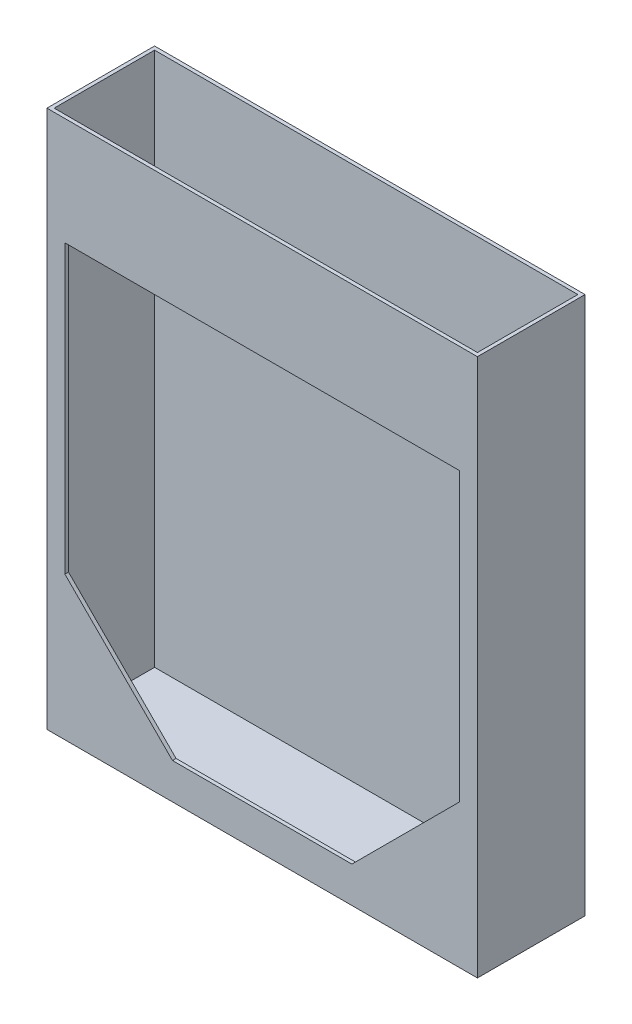
from build123d import *

# Parameters (mm, degrees)
SKETCH1_W           = 304.8
SKETCH1_H           = 76.2
BOSS_EXTRUDE1_DEPTH = 190.5
SHELL1_T            = -2.54
CUT_EXTRUDE1_REACH  = 257.583


with BuildPart() as part:
    # Sketch1 → Boss-Extrude1 (new, symmetric)
    with BuildSketch(Plane(origin=(0, 0, 0), x_dir=(1, 0, 0), z_dir=(0, 1, 0))):
        Rectangle(SKETCH1_W, SKETCH1_H)
    extrude(amount=BOSS_EXTRUDE1_DEPTH, both=True)

    # Shell1
    shell1_openings = [part.faces().sort_by_distance(p)[0] for p in [
        (0, 190.5, 0),
    ]]
    offset(amount=SHELL1_T, openings=shell1_openings, kind=Kind.INTERSECTION)

    # Sketch2 → Cut-Extrude1 (cut, up to next)
    with BuildSketch(Plane.XY.offset(38.1), mode=Mode.PRIVATE) as cut_extrude1_sk1:
        Polygon((-139.7, 114.3), (139.7, 114.3), (139.7, -88.9), (63.5, -165.1), (-63.5, -165.1), (-139.7, -88.9), align=None)
    cut_extrude1_tool1 = extrude(cut_extrude1_sk1.sketch, amount=-CUT_EXTRUDE1_REACH, mode=Mode.PRIVATE) & part.part
    add(cut_extrude1_tool1.solids().sort_by_distance((0, -16.215179, 38.1))[0], mode=Mode.SUBTRACT)


solid = part.part
